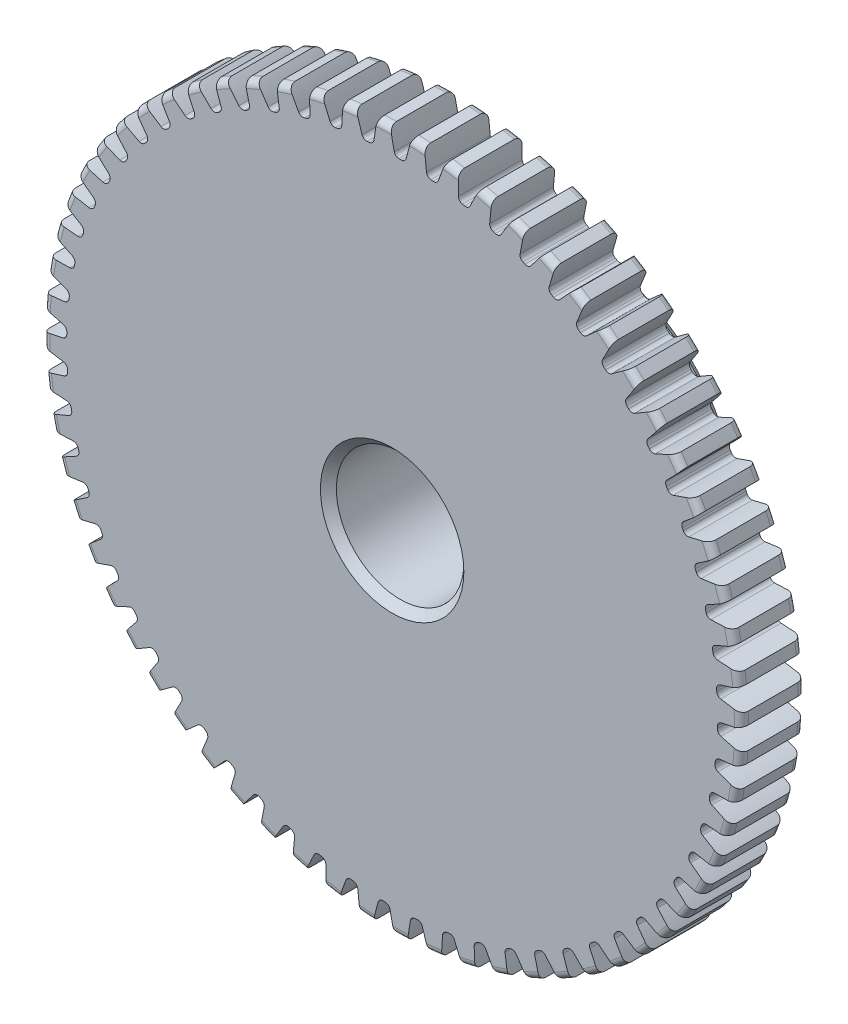
from build123d import *
from OCP.BRepAlgoAPI import BRepAlgoAPI_Cut
from OCP.TopTools import TopTools_ListOfShape

# Parameters (mm, degrees)
SKETCH1_R           = 17.399
BOSS_EXTRUDE1_DEPTH = 3.175
SKETCH2_W           = 6.35
SKETCH2_H           = 7.9375
FILLET2_R           = 0.34798
CUT_EXTRUDE1_DEPTH  = 27.385147849
FILLET1_R           = 0.249302159
CIRPATTERN1_START   = -4
CIRPATTERN1_DEPTH   = 5
SKETCH5_R           = 3.175
CUT_EXTRUDE2_DEPTH  = 27.384461792
CHAMFER1_SIZE       = 0.396875


with BuildPart() as part:
    # Sketch1 → Boss-Extrude1 (new body)
    with BuildSketch(Plane.XY):
        Circle(SKETCH1_R)
    extrude(amount=-BOSS_EXTRUDE1_DEPTH)

    # Sketch2 → Revolve1 (revolve)
    with BuildSketch(Plane(origin=(0, 0, 0), x_dir=(0, 0, -1), z_dir=(1, 0, 0)), mode=Mode.PRIVATE) as revolve1_sk:
        with Locations((6.35, 3.96875)):
            Rectangle(SKETCH2_W, SKETCH2_H)
    revolve(revolve1_sk.sketch.rotate(Axis((0, 0, -3.175), (0, 0, -1)), 90), axis=Axis((0, 0, -3.175), (0, 0, -1)))

    # Fillet2
    fillet2_edges = [part.edges().sort_by_distance(p)[0] for p in [
        (-17.399, 0, 0),
        (-17.399, 0, -3.175),
        (-7.9375, 0, -3.175),
    ]]
    fillet(fillet2_edges, radius=FILLET2_R)

    # Sketch4 → Cut-Extrude1 (cut, through all)
    with BuildSketch(Plane.XY):
        with BuildLine():
            Line((0.106506839, 16.389522157), (0.106506839, 16.208322725))
            ThreePointArc((0.106506839, 16.208322725), (0.39778167, 16.203790884), (0.688928013, 16.194025055))
            Line((0.688928013, 16.194025055), (0.697819068, 16.375006222))
            add(Edge.make_bspline(
                [(2.654676978, 19.79839862), (1.092607111, 18.320634432), (0.697819068, 16.375006222)],
                knots=[0, 0, 0, 1, 1, 1], degree=2))
            ThreePointArc((2.654676978, 19.79839862), (0.490226482, 19.969566239), (-1.680015643, 19.9048096))
            add(Edge.make_bspline(
                [(-1.680015643, 19.9048096), (-0.192337988, 18.352178138), (0.106506839, 16.389522157)],
                knots=[0, 0, 0, 1, 1, 1], degree=2))
        make_face()
    extrude(amount=-CUT_EXTRUDE1_DEPTH, mode=Mode.SUBTRACT)

    # Fillet1
    # the kernel refuses this fillet: 0.249302159 mm, written as the material it adds along each edge
    with BuildSketch(Plane(origin=(0.688928013, 16.194025055, 0), x_dir=(0.04906778897681205, 0.9987954505728023, 0), z_dir=(0, 0, -1))) as fillet1_piece_1:
        with BuildLine():
            CenterArc((0.24598848, -0.240736257), FILLET1_R, 105.063038018, 73.728001554)
            Line((-0.003258183, -0.235476287), (-0.008243116, -0.235371088))
            ThreePointArc((-0.008243116, -0.235371088), (-0.006186992, -0.117675078), (-0.004985936, 3.2763e-05))
            Line((-0.004985936, 3.2763e-05), (0, 0.004986043))
            ThreePointArc((0, 0.004986043), (0.090599716, 0.004986043), (0.17990365, 0.004814725))
            Line((0.17990365, 0.004814725), (0.181199431, 0))
        make_face()
    extrude(amount=3.175)
    with BuildSketch(Plane(origin=(0.106506839, 16.208322725, 0), x_dir=(0, 1, 0), z_dir=(0, 0, -1))) as fillet1_piece_2:
        with BuildLine():
            CenterArc((0.24598848, 0.240736257), FILLET1_R, 181.208960428, 73.728001554)
            Line((-0.003258183, 0.235476287), (-0.008243116, 0.235371088))
            ThreePointArc((-0.008243116, 0.235371088), (-0.006186992, 0.117675078), (-0.004985936, -3.2763e-05))
            Line((-0.004985936, -3.2763e-05), (0, -0.004986043))
            ThreePointArc((0, -0.004986043), (0.090599716, -0.004986043), (0.17990365, -0.004814725))
            Line((0.17990365, -0.004814725), (0.181199431, 0))
        make_face()
    extrude(amount=3.175)


with BuildPart() as cirpattern1_tool:
    # CirPattern1: read off the stored shape, not the designer's step
    # CirPattern1 outline → CirPattern1 (new body)
    with BuildSketch(Plane.XY.offset(CIRPATTERN1_START)):
        with BuildLine():
            ThreePointArc((-1.136714166, 16.168764646), (-0.99101727, 16.228975655), (-0.910572404, 16.364554321))
            add(Edge.make_bspline(
                [(-0.910572404, 16.364554321), (-0.857127813, 16.886611803), (-0.71930774, 17.384129347)],
                knots=[0, 0, 0, 0.264338862, 0.264338862, 0.264338862], degree=2))
            ThreePointArc((-0.71930774, 17.384129347), (-1.279948846, 17.351856729), (-1.839256768, 17.301512522))
            add(Edge.make_bspline(
                [(-1.839256768, 17.301512522), (-1.629927931, 16.829606686), (-1.500460114, 16.321041623)],
                knots=[0.735661138, 0.735661138, 0.735661138, 1, 1, 1], degree=2))
            ThreePointArc((-1.500460114, 16.321041623), (-1.400992434, 16.198734094), (-1.248037701, 16.160552935))
            ThreePointArc((-1.248037701, 16.160552935), (-1.192383003, 16.164754624), (-1.136714166, 16.168764646))
        make_face()
        with BuildLine():
            add(Edge.make_bspline(
                [(2.299490162, 16.227757862), (2.453756192, 16.729357633), (2.685988949, 17.190428155)],
                knots=[0, 0, 0, 0.264338862, 0.264338862, 0.264338862], degree=2))
            ThreePointArc((2.685988949, 17.190428155), (2.129824329, 17.268151301), (1.571441684, 17.327890005))
            add(Edge.make_bspline(
                [(1.571441684, 17.327890005), (1.684684065, 16.824213677), (1.712448073, 16.300162632)],
                knots=[0.735661138, 0.735661138, 0.735661138, 1, 1, 1], degree=2))
            ThreePointArc((1.712448073, 16.300162632), (1.786143493, 16.160800025), (1.928710469, 16.093512519))
            ThreePointArc((1.928710469, 16.093512519), (1.984115487, 16.08677578), (2.039496979, 16.0798483))
            ThreePointArc((2.039496979, 16.0798483), (2.194140936, 16.110478317), (2.299490162, 16.227757862))
        make_face()
        with BuildLine():
            add(Edge.make_bspline(
                [(3.879015908, 15.924227322), (4.08170448, 16.408291038), (4.358011787, 16.844378589)],
                knots=[0, 0, 0, 0.264338862, 0.264338862, 0.264338862], degree=2))
            ThreePointArc((4.358011787, 16.844378589), (3.812143452, 16.976241142), (3.262304989, 17.090423259))
            add(Edge.make_bspline(
                [(3.262304989, 17.090423259), (3.325633163, 16.578072576), (3.301897495, 16.05382363)],
                knots=[0.735661138, 0.735661138, 0.735661138, 1, 1, 1], degree=2))
            ThreePointArc((3.301897495, 16.05382363), (3.361578128, 15.907908679), (3.496863276, 15.826971173))
            ThreePointArc((3.496863276, 15.826971173), (3.551341188, 15.814836232), (3.605776991, 15.802513774))
            ThreePointArc((3.605776991, 15.802513774), (3.762678561, 15.81783854), (3.879015908, 15.924227322))
        make_face()
        with BuildLine():
            add(Edge.make_bspline(
                [(5.42118461, 15.467337769), (5.670343722, 15.929203631), (5.988064589, 16.336108449)],
                knots=[0, 0, 0, 0.264338862, 0.264338862, 0.264338862], degree=2))
            ThreePointArc((5.988064589, 16.336108449), (5.45774955, 16.520840501), (4.921750514, 16.688366394))
            add(Edge.make_bspline(
                [(4.921750514, 16.688366394), (4.934554597, 16.172275572), (4.85954784, 15.652877532)],
                knots=[0.735661138, 0.735661138, 0.735661138, 1, 1, 1], degree=2))
            ThreePointArc((4.85954784, 15.652877532), (4.904638928, 15.501815475), (5.031339378, 15.408007442))
            ThreePointArc((5.031339378, 15.408007442), (5.084365532, 15.390591165), (5.1373314, 15.372992401))
            ThreePointArc((5.1373314, 15.372992401), (5.294979536, 15.372864332), (5.42118461, 15.467337769))
        make_face()
        with BuildLine():
            add(Edge.make_bspline(
                [(6.911144341, 14.861489297), (7.204374455, 15.296709286), (7.560449055, 15.670512655)],
                knots=[0, 0, 0, 0.264338862, 0.264338862, 0.264338862], degree=2))
            ThreePointArc((7.560449055, 15.670512655), (7.050794536, 15.906335135), (6.533796891, 16.125591437))
            add(Edge.make_bspline(
                [(6.533796891, 16.125591437), (6.495953572, 15.610730715), (6.370398082, 15.101185665)],
                knots=[0.735661138, 0.735661138, 0.735661138, 1, 1, 1], degree=2))
            ThreePointArc((6.370398082, 15.101185665), (6.400465374, 14.946431315), (6.517360931, 14.840656177))
            ThreePointArc((6.517360931, 14.840656177), (6.568424656, 14.818126292), (6.619410498, 14.795420708))
            ThreePointArc((6.619410498, 14.795420708), (6.776286962, 14.779841036), (6.911144341, 14.861489297))
        make_face()
        with BuildLine():
            add(Edge.make_bspline(
                [(8.334545974, 14.112516559), (8.669023124, 14.516899267), (9.060022264, 14.854001257)],
                knots=[0, 0, 0, 0.264338862, 0.264338862, 0.264338862], degree=2))
            ThreePointArc((9.060022264, 14.854001257), (8.575936516, 15.138643067), (8.082919232, 15.40751822))
            add(Edge.make_bspline(
                [(8.082919232, 15.40751822), (7.994792963, 14.898845987), (7.819897909, 14.404061126)],
                knots=[0.735661138, 0.735661138, 0.735661138, 1, 1, 1], degree=2))
            ThreePointArc((7.819897909, 14.404061126), (7.834651839, 14.24710485), (7.940616736, 14.13038128))
            ThreePointArc((7.940616736, 14.13038128), (7.98922626, 14.102954763), (8.037741055, 14.075361026))
            ThreePointArc((8.037741055, 14.075361026), (8.192335041, 14.044479791), (8.334545974, 14.112516559))
        make_face()
        with BuildLine():
            add(Edge.make_bspline(
                [(9.677681373, 13.227632573), (10.05018436, 13.597283574), (10.472342506, 13.894437707)],
                knots=[0, 0, 0, 0.264338862, 0.264338862, 0.264338862], degree=2))
            ThreePointArc((10.472342506, 13.894437707), (10.018487539, 14.22515759), (9.554198642, 14.54106218))
            add(Edge.make_bspline(
                [(9.554198642, 14.54106218), (9.416638128, 14.043477227), (9.194087844, 13.568217604)],
                knots=[0.735661138, 0.735661138, 0.735661138, 1, 1, 1], degree=2))
            ThreePointArc((9.194087844, 13.568217604), (9.193386324, 13.410570977), (9.287400061, 13.284023087))
            ThreePointArc((9.287400061, 13.284023087), (9.333087248, 13.251964069), (9.378663772, 13.219747922))
            ThreePointArc((9.378663772, 13.219747922), (9.529486456, 13.173862529), (9.677681373, 13.227632573))
        make_face()
        with BuildLine():
            add(Edge.make_bspline(
                [(10.92761541, 12.215359253), (11.334556828, 12.546718606), (11.783808365, 12.801063127)],
                knots=[0, 0, 0, 0.264338862, 0.264338862, 0.264338862], degree=2))
            ThreePointArc((11.783808365, 12.801063127), (11.364555051, 13.174676069), (10.933465897, 13.534567763))
            add(Edge.make_bspline(
                [(10.933465897, 13.534567763), (10.747795919, 13.052862105), (10.479733687, 12.601704729)],
                knots=[0.735661138, 0.735661138, 0.735661138, 1, 1, 1], degree=2))
            ThreePointArc((10.479733687, 12.601704729), (10.463583474, 12.444885975), (10.544740646, 12.30973249))
            ThreePointArc((10.544740646, 12.30973249), (10.587065504, 12.273349718), (10.62926483, 12.23682142))
            ThreePointArc((10.62926483, 12.23682142), (10.774863706, 12.176373769), (10.92761541, 12.215359253))
        make_face()
        with BuildLine():
            add(Edge.make_bspline(
                [(12.072310537, 11.085445346), (12.509771317, 11.375321879), (12.981789708, 11.584407311)],
                knots=[0, 0, 0, 0.264338862, 0.264338862, 0.264338862], degree=2))
            ThreePointArc((12.981789708, 11.584407311), (12.601175686, 11.997315215), (12.207437898, 12.397728058))
            add(Edge.make_bspline(
                [(12.207437898, 12.397728058), (11.975446561, 11.936540786), (11.664453965, 11.513830549)],
                knots=[0.735661138, 0.735661138, 0.735661138, 1, 1, 1], degree=2))
            ThreePointArc((11.664453965, 11.513830549), (11.633010594, 11.359349918), (11.700529615, 11.21689244))
            ThreePointArc((11.700529615, 11.21689244), (11.739084531, 11.176536299), (11.777500257, 11.136047638))
            ThreePointArc((11.777500257, 11.136047638), (11.916473128, 11.061619873), (12.072310537, 11.085445346))
        make_face()
        with BuildLine():
            add(Edge.make_bspline(
                [(13.100742714, 9.848772541), (13.56450987, 10.094374585), (14.054749319, 10.25618732)],
                knots=[0, 0, 0, 0.264338862, 0.264338862, 0.264338862], degree=2))
            ThreePointArc((14.054749319, 10.25618732), (13.716440109, 10.704413658), (13.363845598, 11.141491456))
            add(Edge.make_bspline(
                [(13.363845598, 11.141491456), (13.087767106, 10.705264053), (12.736839176, 10.315071887)],
                knots=[0.735661138, 0.735661138, 0.735661138, 1, 1, 1], degree=2))
            ThreePointArc((12.736839176, 10.315071887), (12.690405464, 10.164417111), (12.743636087, 10.016027584))
            ThreePointArc((12.743636087, 10.016027584), (12.778049757, 9.972086726), (12.812311918, 9.928027629))
            ThreePointArc((12.812311918, 9.928027629), (12.9433204, 9.840336531), (13.100742714, 9.848772541))
        make_face()
        with BuildLine():
            add(Edge.make_bspline(
                [(14.003007577, 8.517250672), (14.488614777, 8.716212944), (14.992354012, 8.829194638)],
                knots=[0, 0, 0, 0.264338862, 0.264338862, 0.264338862], degree=2))
            ThreePointArc((14.992354012, 8.829194638), (14.699607717, 9.308422745), (14.391552161, 9.7779562))
            add(Edge.make_bspline(
                [(14.391552161, 9.7779562), (14.074045299, 9.370889776), (13.686561663, 9.016973444)],
                knots=[0.735661138, 0.735661138, 0.735661138, 1, 1, 1], degree=2))
            ThreePointArc((13.686561663, 9.016973444), (13.625584791, 8.871595411), (13.664014377, 8.718702906))
            ThreePointArc((13.664014377, 8.718702906), (13.693955379, 8.671600507), (13.723734011, 8.624395287))
            ThreePointArc((13.723734011, 8.624395287), (13.845516421, 8.524285369), (14.003007577, 8.517250672))
        make_face()
        with BuildLine():
            add(Edge.make_bspline(
                [(14.770415823, 7.103703023), (15.273186404, 7.254109409), (15.785574139, 7.317171986)],
                knots=[0, 0, 0, 0.264338862, 0.264338862, 0.264338862], degree=2))
            ThreePointArc((15.785574139, 7.317171986), (15.541210067, 7.822786633), (15.280660208, 8.32025388))
            add(Edge.make_bspline(
                [(15.280660208, 8.32025388), (14.924782742, 7.946268707), (14.504475079, 7.632036617)],
                knots=[0.735661138, 0.735661138, 0.735661138, 1, 1, 1], degree=2))
            ThreePointArc((14.504475079, 7.632036617), (14.429542288, 7.493335398), (14.45280074, 7.337412354))
            ThreePointArc((14.45280074, 7.337412354), (14.477980725, 7.287602034), (14.502989044, 7.237705304))
            ThreePointArc((14.502989044, 7.237705304), (14.614372551, 7.126140679), (14.770415823, 7.103703023))
        make_face()
        with BuildLine():
            add(Edge.make_bspline(
                [(15.39557689, 5.621742831), (15.910668897, 5.722144834), (16.426770558, 5.734680967)],
                knots=[0, 0, 0, 0.264338862, 0.264338862, 0.264338862], degree=2))
            ThreePointArc((16.426770558, 5.734680967), (16.233142067, 6.261812809), (16.022607145, 6.782422968))
            add(Edge.make_bspline(
                [(16.022607145, 6.782422968), (15.631786369, 6.445120727), (15.182702471, 6.173599105)],
                knots=[0.735661138, 0.735661138, 0.735661138, 1, 1, 1], degree=2))
            ThreePointArc((15.182702471, 6.173599105), (15.094535405, 6.042910469), (15.10239873, 5.88545851))
            ThreePointArc((15.10239873, 5.88545851), (15.122575202, 5.83341997), (15.142572364, 5.781312263))
            ThreePointArc((15.142572364, 5.781312263), (15.242484283, 5.659367359), (15.39557689, 5.621742831))
        make_face()
        with BuildLine():
            add(Edge.make_bspline(
                [(15.872470135, 4.085642183), (16.394922951, 4.135072877), (16.909768197, 4.096961836)],
                knots=[0, 0, 0, 0.264338862, 0.264338862, 0.264338862], degree=2))
            ThreePointArc((16.909768197, 4.096961836), (16.768740036, 4.640534305), (16.610247616, 5.179273615))
            add(Edge.make_bspline(
                [(16.610247616, 5.179273615), (16.188247347, 4.881902711), (15.714712138, 4.655706459)],
                knots=[0.735661138, 0.735661138, 0.735661138, 1, 1, 1], degree=2))
            ThreePointArc((15.714712138, 4.655706459), (15.614159895, 4.534289008), (15.606552365, 4.376824483))
            ThreePointArc((15.606552365, 4.376824483), (15.621531013, 4.323058883), (15.636324435, 4.269242023))
            ThreePointArc((15.636324435, 4.269242023), (15.72380256, 4.138091237), (15.872470135, 4.085642183))
        make_face()
        with BuildLine():
            add(Edge.make_bspline(
                [(16.196502816, 2.510194566), (16.721284934, 2.508177907), (17.229915525, 2.419786722)],
                knots=[0, 0, 0, 0.264338862, 0.264338862, 0.264338862], degree=2))
            ThreePointArc((17.229915525, 2.419786722), (17.142845872, 2.974564919), (17.037922323, 3.526245025))
            add(Edge.make_bspline(
                [(17.037922323, 3.526245025), (16.588806655, 3.271669303), (16.095380538, 3.092976815)],
                knots=[0.735661138, 0.735661138, 0.735661138, 1, 1, 1], degree=2))
            ThreePointArc((16.095380538, 3.092976815), (15.983411489, 2.981999866), (15.960406369, 2.826039244))
            ThreePointArc((15.960406369, 2.826039244), (15.97004294, 2.771064375), (15.979490153, 2.71605665))
            ThreePointArc((15.979490153, 2.71605665), (16.053692022, 2.576963035), (16.196502816, 2.510194566))
        make_face()
        with BuildLine():
            add(Edge.make_bspline(
                [(16.364554321, 0.910572404), (16.886611803, 0.857127813), (17.384129347, 0.71930774)],
                knots=[0, 0, 0, 0.264338862, 0.264338862, 0.264338862], degree=2))
            ThreePointArc((17.384129347, 0.71930774), (17.351856731, 1.279948846), (17.301512523, 1.839256768))
            add(Edge.make_bspline(
                [(17.301512523, 1.839256768), (16.829606686, 1.629927931), (16.321041623, 1.500460114)],
                knots=[0.735661138, 0.735661138, 0.735661138, 1, 1, 1], degree=2))
            ThreePointArc((16.321041623, 1.500460114), (16.198734094, 1.400992434), (16.160552935, 1.248037701))
            ThreePointArc((16.160552935, 1.248037701), (16.164754624, 1.192383003), (16.168764646, 1.136714166))
            ThreePointArc((16.168764646, 1.136714166), (16.228975655, 0.99101727), (16.364554321, 0.910572404))
        make_face()
        with BuildLine():
            add(Edge.make_bspline(
                [(16.375006222, -0.697819068), (16.889311368, -0.80217689), (17.3709245, -0.988098569)],
                knots=[0, 0, 0, 0.264338862, 0.264338862, 0.264338862], degree=2))
            ThreePointArc((17.3709245, -0.988098569), (17.393759723, -0.426993833), (17.3984797, 0.134555463))
            add(Edge.make_bspline(
                [(17.3984797, 0.134555463), (16.908328404, -0.027510538), (16.389522157, -0.106506839)],
                knots=[0.735661138, 0.735661138, 0.735661138, 1, 1, 1], degree=2))
            ThreePointArc((16.389522157, -0.106506839), (16.258054033, -0.19350732), (16.205064542, -0.341983126))
            ThreePointArc((16.205064542, -0.341983126), (16.203790884, -0.39778167), (16.202325097, -0.453575497))
            ThreePointArc((16.202325097, -0.453575497), (16.24796538, -0.604472533), (16.375006222, -0.697819068))
        make_face()
        with BuildLine():
            add(Edge.make_bspline(
                [(16.227757862, -2.299490162), (16.729357633, -2.453756192), (17.190428155, -2.685988949)],
                knots=[0, 0, 0, 0.264338862, 0.264338862, 0.264338862], degree=2))
            ThreePointArc((17.190428155, -2.685988949), (17.268151302, -2.129824329), (17.327890007, -1.571441684))
            add(Edge.make_bspline(
                [(17.327890007, -1.571441684), (16.824213677, -1.684684065), (16.300162632, -1.712448073)],
                knots=[0.735661138, 0.735661138, 0.735661138, 1, 1, 1], degree=2))
            ThreePointArc((16.300162632, -1.712448073), (16.160800025, -1.786143493), (16.093512519, -1.928710469))
            ThreePointArc((16.093512519, -1.928710469), (16.08677578, -1.984115487), (16.0798483, -2.039496979))
            ThreePointArc((16.0798483, -2.039496979), (16.110478317, -2.194140936), (16.227757862, -2.299490162))
        make_face()
        with BuildLine():
            add(Edge.make_bspline(
                [(15.924227322, -3.879015908), (16.408291038, -4.08170448), (16.844378589, -4.358011787)],
                knots=[0, 0, 0, 0.264338862, 0.264338862, 0.264338862], degree=2))
            ThreePointArc((16.844378589, -4.358011787), (16.976241143, -3.812143452), (17.09042326, -3.26230499))
            add(Edge.make_bspline(
                [(17.09042326, -3.26230499), (16.578072576, -3.325633163), (16.05382363, -3.301897495)],
                knots=[0.735661138, 0.735661138, 0.735661138, 1, 1, 1], degree=2))
            ThreePointArc((16.05382363, -3.301897495), (15.907908679, -3.361578128), (15.826971173, -3.496863276))
            ThreePointArc((15.826971173, -3.496863276), (15.814836232, -3.551341188), (15.802513774, -3.605776991))
            ThreePointArc((15.802513774, -3.605776991), (15.81783854, -3.762678561), (15.924227322, -3.879015908))
        make_face()
        with BuildLine():
            add(Edge.make_bspline(
                [(15.467337769, -5.42118461), (15.929203631, -5.670343722), (16.336108449, -5.988064589)],
                knots=[0, 0, 0, 0.264338862, 0.264338862, 0.264338862], degree=2))
            ThreePointArc((16.336108449, -5.988064589), (16.520840502, -5.45774955), (16.688366395, -4.921750514))
            add(Edge.make_bspline(
                [(16.688366395, -4.921750514), (16.172275572, -4.934554597), (15.652877532, -4.85954784)],
                knots=[0.735661138, 0.735661138, 0.735661138, 1, 1, 1], degree=2))
            ThreePointArc((15.652877532, -4.85954784), (15.501815475, -4.904638928), (15.408007442, -5.031339378))
            ThreePointArc((15.408007442, -5.031339378), (15.390591165, -5.084365532), (15.372992401, -5.1373314))
            ThreePointArc((15.372992401, -5.1373314), (15.372864332, -5.294979536), (15.467337769, -5.42118461))
        make_face()
        with BuildLine():
            add(Edge.make_bspline(
                [(14.861489297, -6.911144341), (15.296709286, -7.204374455), (15.670512655, -7.560449055)],
                knots=[0, 0, 0, 0.264338862, 0.264338862, 0.264338862], degree=2))
            ThreePointArc((15.670512655, -7.560449055), (15.906335136, -7.050794536), (16.125591438, -6.533796891))
            add(Edge.make_bspline(
                [(16.125591438, -6.533796891), (15.610730715, -6.495953572), (15.101185665, -6.370398082)],
                knots=[0.735661138, 0.735661138, 0.735661138, 1, 1, 1], degree=2))
            ThreePointArc((15.101185665, -6.370398082), (14.946431315, -6.400465374), (14.840656177, -6.517360931))
            ThreePointArc((14.840656177, -6.517360931), (14.818126292, -6.568424656), (14.795420708, -6.619410498))
            ThreePointArc((14.795420708, -6.619410498), (14.779841036, -6.776286962), (14.861489297, -6.911144341))
        make_face()
        with BuildLine():
            add(Edge.make_bspline(
                [(14.112516559, -8.334545974), (14.516899267, -8.669023124), (14.854001257, -9.060022264)],
                knots=[0, 0, 0, 0.264338862, 0.264338862, 0.264338862], degree=2))
            ThreePointArc((14.854001257, -9.060022264), (15.138643067, -8.575936516), (15.407518221, -8.082919232))
            add(Edge.make_bspline(
                [(15.407518221, -8.082919232), (14.898845987, -7.994792963), (14.404061126, -7.819897909)],
                knots=[0.735661138, 0.735661138, 0.735661138, 1, 1, 1], degree=2))
            ThreePointArc((14.404061126, -7.819897909), (14.24710485, -7.834651839), (14.13038128, -7.940616736))
            ThreePointArc((14.13038128, -7.940616736), (14.102954763, -7.98922626), (14.075361026, -8.037741055))
            ThreePointArc((14.075361026, -8.037741055), (14.044479791, -8.192335041), (14.112516559, -8.334545974))
        make_face()
        with BuildLine():
            add(Edge.make_bspline(
                [(13.227632573, -9.677681373), (13.597283574, -10.05018436), (13.894437707, -10.472342506)],
                knots=[0, 0, 0, 0.264338862, 0.264338862, 0.264338862], degree=2))
            ThreePointArc((13.894437707, -10.472342506), (14.22515759, -10.01848754), (14.541062181, -9.554198642))
            add(Edge.make_bspline(
                [(14.541062181, -9.554198642), (14.043477227, -9.416638128), (13.568217604, -9.194087844)],
                knots=[0.735661138, 0.735661138, 0.735661138, 1, 1, 1], degree=2))
            ThreePointArc((13.568217604, -9.194087844), (13.410570977, -9.193386324), (13.284023087, -9.287400061))
            ThreePointArc((13.284023087, -9.287400061), (13.251964069, -9.333087248), (13.219747922, -9.378663772))
            ThreePointArc((13.219747922, -9.378663772), (13.173862529, -9.529486456), (13.227632573, -9.677681373))
        make_face()
        with BuildLine():
            add(Edge.make_bspline(
                [(12.215359253, -10.92761541), (12.546718606, -11.334556828), (12.801063127, -11.783808365)],
                knots=[0, 0, 0, 0.264338862, 0.264338862, 0.264338862], degree=2))
            ThreePointArc((12.801063127, -11.783808365), (13.174676069, -11.364555051), (13.534567763, -10.933465897))
            add(Edge.make_bspline(
                [(13.534567763, -10.933465897), (13.052862105, -10.747795919), (12.601704729, -10.479733687)],
                knots=[0.735661138, 0.735661138, 0.735661138, 1, 1, 1], degree=2))
            ThreePointArc((12.601704729, -10.479733687), (12.444885975, -10.463583474), (12.30973249, -10.544740646))
            ThreePointArc((12.30973249, -10.544740646), (12.273349718, -10.587065504), (12.23682142, -10.62926483))
            ThreePointArc((12.23682142, -10.62926483), (12.176373769, -10.774863706), (12.215359253, -10.92761541))
        make_face()
        with BuildLine():
            add(Edge.make_bspline(
                [(11.085445346, -12.072310537), (11.375321879, -12.509771317), (11.584407311, -12.981789708)],
                knots=[0, 0, 0, 0.264338862, 0.264338862, 0.264338862], degree=2))
            ThreePointArc((11.584407311, -12.981789708), (11.997315215, -12.601175685), (12.397728058, -12.207437898))
            add(Edge.make_bspline(
                [(12.397728058, -12.207437898), (11.936540786, -11.975446561), (11.513830549, -11.664453965)],
                knots=[0.735661138, 0.735661138, 0.735661138, 1, 1, 1], degree=2))
            ThreePointArc((11.513830549, -11.664453965), (11.359349918, -11.633010594), (11.21689244, -11.700529615))
            ThreePointArc((11.21689244, -11.700529615), (11.176536299, -11.739084531), (11.136047638, -11.777500257))
            ThreePointArc((11.136047638, -11.777500257), (11.061619873, -11.916473128), (11.085445346, -12.072310537))
        make_face()
        with BuildLine():
            add(Edge.make_bspline(
                [(9.848772541, -13.100742714), (10.094374585, -13.56450987), (10.25618732, -14.054749319)],
                knots=[0, 0, 0, 0.264338862, 0.264338862, 0.264338862], degree=2))
            ThreePointArc((10.25618732, -14.054749319), (10.704413658, -13.716440109), (11.141491456, -13.363845598))
            add(Edge.make_bspline(
                [(11.141491456, -13.363845598), (10.705264053, -13.087767106), (10.315071887, -12.736839176)],
                knots=[0.735661138, 0.735661138, 0.735661138, 1, 1, 1], degree=2))
            ThreePointArc((10.315071887, -12.736839176), (10.164417111, -12.690405464), (10.016027584, -12.743636087))
            ThreePointArc((10.016027584, -12.743636087), (9.972086726, -12.778049757), (9.928027629, -12.812311918))
            ThreePointArc((9.928027629, -12.812311918), (9.840336531, -12.9433204), (9.848772541, -13.100742714))
        make_face()
        with BuildLine():
            add(Edge.make_bspline(
                [(8.517250672, -14.003007577), (8.716212944, -14.488614777), (8.829194638, -14.992354012)],
                knots=[0, 0, 0, 0.264338862, 0.264338862, 0.264338862], degree=2))
            ThreePointArc((8.829194638, -14.992354012), (9.308422745, -14.699607717), (9.7779562, -14.39155216))
            add(Edge.make_bspline(
                [(9.7779562, -14.39155216), (9.370889776, -14.074045299), (9.016973444, -13.686561663)],
                knots=[0.735661138, 0.735661138, 0.735661138, 1, 1, 1], degree=2))
            ThreePointArc((9.016973444, -13.686561663), (8.871595411, -13.625584791), (8.718702906, -13.664014377))
            ThreePointArc((8.718702906, -13.664014377), (8.671600507, -13.693955379), (8.624395287, -13.723734011))
            ThreePointArc((8.624395287, -13.723734011), (8.524285369, -13.845516421), (8.517250672, -14.003007577))
        make_face()
        with BuildLine():
            add(Edge.make_bspline(
                [(7.103703023, -14.770415823), (7.254109409, -15.273186404), (7.317171986, -15.785574139)],
                knots=[0, 0, 0, 0.264338862, 0.264338862, 0.264338862], degree=2))
            ThreePointArc((7.317171986, -15.785574139), (7.822786633, -15.541210066), (8.32025388, -15.280660208))
            add(Edge.make_bspline(
                [(8.32025388, -15.280660208), (7.946268707, -14.924782742), (7.632036617, -14.504475079)],
                knots=[0.735661138, 0.735661138, 0.735661138, 1, 1, 1], degree=2))
            ThreePointArc((7.632036617, -14.504475079), (7.493335398, -14.429542288), (7.337412354, -14.45280074))
            ThreePointArc((7.337412354, -14.45280074), (7.287602034, -14.477980725), (7.237705304, -14.502989044))
            ThreePointArc((7.237705304, -14.502989044), (7.126140679, -14.614372551), (7.103703023, -14.770415823))
        make_face()
        with BuildLine():
            add(Edge.make_bspline(
                [(5.621742831, -15.39557689), (5.722144834, -15.910668897), (5.734680967, -16.426770558)],
                knots=[0, 0, 0, 0.264338862, 0.264338862, 0.264338862], degree=2))
            ThreePointArc((5.734680967, -16.426770558), (6.261812809, -16.233142067), (6.782422968, -16.022607144))
            add(Edge.make_bspline(
                [(6.782422968, -16.022607144), (6.445120727, -15.631786369), (6.173599105, -15.182702471)],
                knots=[0.735661138, 0.735661138, 0.735661138, 1, 1, 1], degree=2))
            ThreePointArc((6.173599105, -15.182702471), (6.042910469, -15.094535405), (5.88545851, -15.10239873))
            ThreePointArc((5.88545851, -15.10239873), (5.83341997, -15.122575202), (5.781312263, -15.142572364))
            ThreePointArc((5.781312263, -15.142572364), (5.659367359, -15.242484283), (5.621742831, -15.39557689))
        make_face()
        with BuildLine():
            add(Edge.make_bspline(
                [(4.085642183, -15.872470135), (4.135072877, -16.394922951), (4.096961836, -16.909768197)],
                knots=[0, 0, 0, 0.264338862, 0.264338862, 0.264338862], degree=2))
            ThreePointArc((4.096961836, -16.909768197), (4.640534305, -16.768740035), (5.179273614, -16.610247615))
            add(Edge.make_bspline(
                [(5.179273614, -16.610247615), (4.881902711, -16.188247347), (4.655706459, -15.714712138)],
                knots=[0.735661138, 0.735661138, 0.735661138, 1, 1, 1], degree=2))
            ThreePointArc((4.655706459, -15.714712138), (4.534289008, -15.614159895), (4.376824483, -15.606552365))
            ThreePointArc((4.376824483, -15.606552365), (4.323058883, -15.621531013), (4.269242023, -15.636324435))
            ThreePointArc((4.269242023, -15.636324435), (4.138091237, -15.72380256), (4.085642183, -15.872470135))
        make_face()
        with BuildLine():
            add(Edge.make_bspline(
                [(2.510194566, -16.196502816), (2.508177907, -16.721284934), (2.419786722, -17.229915525)],
                knots=[0, 0, 0, 0.264338862, 0.264338862, 0.264338862], degree=2))
            ThreePointArc((2.419786722, -17.229915525), (2.974564919, -17.142845871), (3.526245025, -17.037922322))
            add(Edge.make_bspline(
                [(3.526245025, -17.037922322), (3.271669303, -16.588806655), (3.092976815, -16.095380538)],
                knots=[0.735661138, 0.735661138, 0.735661138, 1, 1, 1], degree=2))
            ThreePointArc((3.092976815, -16.095380538), (2.981999866, -15.983411489), (2.826039244, -15.960406369))
            ThreePointArc((2.826039244, -15.960406369), (2.771064375, -15.97004294), (2.71605665, -15.979490153))
            ThreePointArc((2.71605665, -15.979490153), (2.576963035, -16.053692022), (2.510194566, -16.196502816))
        make_face()
        with BuildLine():
            add(Edge.make_bspline(
                [(0.910572404, -16.364554321), (0.857127813, -16.886611803), (0.71930774, -17.384129347)],
                knots=[0, 0, 0, 0.264338862, 0.264338862, 0.264338862], degree=2))
            ThreePointArc((0.71930774, -17.384129347), (1.279948846, -17.351856729), (1.839256768, -17.301512522))
            add(Edge.make_bspline(
                [(1.839256768, -17.301512522), (1.629927931, -16.829606686), (1.500460114, -16.321041623)],
                knots=[0.735661138, 0.735661138, 0.735661138, 1, 1, 1], degree=2))
            ThreePointArc((1.500460114, -16.321041623), (1.400992434, -16.198734094), (1.248037701, -16.160552935))
            ThreePointArc((1.248037701, -16.160552935), (1.192383003, -16.164754624), (1.136714166, -16.168764646))
            ThreePointArc((1.136714166, -16.168764646), (0.99101727, -16.228975655), (0.910572404, -16.364554321))
        make_face()
        with BuildLine():
            add(Edge.make_bspline(
                [(-0.697819068, -16.375006222), (-0.80217689, -16.889311368), (-0.988098569, -17.3709245)],
                knots=[0, 0, 0, 0.264338862, 0.264338862, 0.264338862], degree=2))
            ThreePointArc((-0.988098569, -17.3709245), (-0.426993833, -17.393759722), (0.134555463, -17.398479699))
            add(Edge.make_bspline(
                [(0.134555463, -17.398479699), (-0.027510538, -16.908328404), (-0.106506839, -16.389522157)],
                knots=[0.735661138, 0.735661138, 0.735661138, 1, 1, 1], degree=2))
            ThreePointArc((-0.106506839, -16.389522157), (-0.19350732, -16.258054033), (-0.341983126, -16.205064542))
            ThreePointArc((-0.341983126, -16.205064542), (-0.39778167, -16.203790884), (-0.453575497, -16.202325097))
            ThreePointArc((-0.453575497, -16.202325097), (-0.604472533, -16.24796538), (-0.697819068, -16.375006222))
        make_face()
        with BuildLine():
            add(Edge.make_bspline(
                [(-2.299490162, -16.227757862), (-2.453756192, -16.729357633), (-2.685988949, -17.190428155)],
                knots=[0, 0, 0, 0.264338862, 0.264338862, 0.264338862], degree=2))
            ThreePointArc((-2.685988949, -17.190428155), (-2.129824329, -17.2681513), (-1.571441684, -17.327890005))
            add(Edge.make_bspline(
                [(-1.571441684, -17.327890005), (-1.684684065, -16.824213677), (-1.712448073, -16.300162632)],
                knots=[0.735661138, 0.735661138, 0.735661138, 1, 1, 1], degree=2))
            ThreePointArc((-1.712448073, -16.300162632), (-1.786143493, -16.160800025), (-1.928710469, -16.093512519))
            ThreePointArc((-1.928710469, -16.093512519), (-1.984115487, -16.08677578), (-2.039496979, -16.0798483))
            ThreePointArc((-2.039496979, -16.0798483), (-2.194140936, -16.110478317), (-2.299490162, -16.227757862))
        make_face()
        with BuildLine():
            add(Edge.make_bspline(
                [(-3.879015908, -15.924227322), (-4.08170448, -16.408291038), (-4.358011787, -16.844378589)],
                knots=[0, 0, 0, 0.264338862, 0.264338862, 0.264338862], degree=2))
            ThreePointArc((-4.358011787, -16.844378589), (-3.812143452, -16.976241142), (-3.262304989, -17.090423258))
            add(Edge.make_bspline(
                [(-3.262304989, -17.090423258), (-3.325633163, -16.578072576), (-3.301897495, -16.05382363)],
                knots=[0.735661138, 0.735661138, 0.735661138, 1, 1, 1], degree=2))
            ThreePointArc((-3.301897495, -16.05382363), (-3.361578128, -15.907908679), (-3.496863276, -15.826971173))
            ThreePointArc((-3.496863276, -15.826971173), (-3.551341188, -15.814836232), (-3.605776991, -15.802513774))
            ThreePointArc((-3.605776991, -15.802513774), (-3.762678561, -15.81783854), (-3.879015908, -15.924227322))
        make_face()
        with BuildLine():
            add(Edge.make_bspline(
                [(-5.42118461, -15.467337769), (-5.670343722, -15.929203631), (-5.988064589, -16.336108449)],
                knots=[0, 0, 0, 0.264338862, 0.264338862, 0.264338862], degree=2))
            ThreePointArc((-5.988064589, -16.336108449), (-5.457749549, -16.520840501), (-4.921750514, -16.688366393))
            add(Edge.make_bspline(
                [(-4.921750514, -16.688366393), (-4.934554597, -16.172275572), (-4.85954784, -15.652877532)],
                knots=[0.735661138, 0.735661138, 0.735661138, 1, 1, 1], degree=2))
            ThreePointArc((-4.85954784, -15.652877532), (-4.904638928, -15.501815475), (-5.031339378, -15.408007442))
            ThreePointArc((-5.031339378, -15.408007442), (-5.084365532, -15.390591165), (-5.1373314, -15.372992401))
            ThreePointArc((-5.1373314, -15.372992401), (-5.294979536, -15.372864332), (-5.42118461, -15.467337769))
        make_face()
        with BuildLine():
            add(Edge.make_bspline(
                [(-6.911144341, -14.861489297), (-7.204374455, -15.296709286), (-7.560449055, -15.670512655)],
                knots=[0, 0, 0, 0.264338862, 0.264338862, 0.264338862], degree=2))
            ThreePointArc((-7.560449055, -15.670512655), (-7.050794535, -15.906335134), (-6.533796891, -16.125591437))
            add(Edge.make_bspline(
                [(-6.533796891, -16.125591437), (-6.495953572, -15.610730715), (-6.370398082, -15.101185665)],
                knots=[0.735661138, 0.735661138, 0.735661138, 1, 1, 1], degree=2))
            ThreePointArc((-6.370398082, -15.101185665), (-6.400465374, -14.946431315), (-6.517360931, -14.840656177))
            ThreePointArc((-6.517360931, -14.840656177), (-6.568424656, -14.818126292), (-6.619410498, -14.795420708))
            ThreePointArc((-6.619410498, -14.795420708), (-6.776286962, -14.779841036), (-6.911144341, -14.861489297))
        make_face()
        with BuildLine():
            add(Edge.make_bspline(
                [(-8.334545974, -14.112516559), (-8.669023124, -14.516899267), (-9.060022264, -14.854001257)],
                knots=[0, 0, 0, 0.264338862, 0.264338862, 0.264338862], degree=2))
            ThreePointArc((-9.060022264, -14.854001257), (-8.575936515, -15.138643066), (-8.082919231, -15.407518219))
            add(Edge.make_bspline(
                [(-8.082919231, -15.407518219), (-7.994792963, -14.898845987), (-7.819897909, -14.404061126)],
                knots=[0.735661138, 0.735661138, 0.735661138, 1, 1, 1], degree=2))
            ThreePointArc((-7.819897909, -14.404061126), (-7.834651839, -14.24710485), (-7.940616736, -14.13038128))
            ThreePointArc((-7.940616736, -14.13038128), (-7.98922626, -14.102954763), (-8.037741055, -14.075361026))
            ThreePointArc((-8.037741055, -14.075361026), (-8.192335041, -14.044479791), (-8.334545974, -14.112516559))
        make_face()
        with BuildLine():
            add(Edge.make_bspline(
                [(-9.677681373, -13.227632573), (-10.05018436, -13.597283574), (-10.472342506, -13.894437707)],
                knots=[0, 0, 0, 0.264338862, 0.264338862, 0.264338862], degree=2))
            ThreePointArc((-10.472342506, -13.894437707), (-10.018487539, -14.225157588), (-9.554198641, -14.541062179))
            add(Edge.make_bspline(
                [(-9.554198641, -14.541062179), (-9.416638128, -14.043477227), (-9.194087844, -13.568217604)],
                knots=[0.735661138, 0.735661138, 0.735661138, 1, 1, 1], degree=2))
            ThreePointArc((-9.194087844, -13.568217604), (-9.193386324, -13.410570977), (-9.287400061, -13.284023087))
            ThreePointArc((-9.287400061, -13.284023087), (-9.333087248, -13.251964069), (-9.378663772, -13.219747922))
            ThreePointArc((-9.378663772, -13.219747922), (-9.529486456, -13.173862529), (-9.677681373, -13.227632573))
        make_face()
        with BuildLine():
            add(Edge.make_bspline(
                [(-10.92761541, -12.215359253), (-11.334556828, -12.546718606), (-11.783808365, -12.801063127)],
                knots=[0, 0, 0, 0.264338862, 0.264338862, 0.264338862], degree=2))
            ThreePointArc((-11.783808365, -12.801063127), (-11.36455505, -13.174676068), (-10.933465896, -13.534567761))
            add(Edge.make_bspline(
                [(-10.933465896, -13.534567761), (-10.747795919, -13.052862105), (-10.479733687, -12.601704729)],
                knots=[0.735661138, 0.735661138, 0.735661138, 1, 1, 1], degree=2))
            ThreePointArc((-10.479733687, -12.601704729), (-10.463583474, -12.444885975), (-10.544740646, -12.30973249))
            ThreePointArc((-10.544740646, -12.30973249), (-10.587065504, -12.273349718), (-10.62926483, -12.23682142))
            ThreePointArc((-10.62926483, -12.23682142), (-10.774863706, -12.176373769), (-10.92761541, -12.215359253))
        make_face()
        with BuildLine():
            add(Edge.make_bspline(
                [(-12.072310537, -11.085445346), (-12.509771317, -11.375321879), (-12.981789708, -11.584407311)],
                knots=[0, 0, 0, 0.264338862, 0.264338862, 0.264338862], degree=2))
            ThreePointArc((-12.981789708, -11.584407311), (-12.601175684, -11.997315214), (-12.207437896, -12.397728057))
            add(Edge.make_bspline(
                [(-12.207437896, -12.397728057), (-11.975446561, -11.936540786), (-11.664453965, -11.513830549)],
                knots=[0.735661138, 0.735661138, 0.735661138, 1, 1, 1], degree=2))
            ThreePointArc((-11.664453965, -11.513830549), (-11.633010594, -11.359349918), (-11.700529615, -11.21689244))
            ThreePointArc((-11.700529615, -11.21689244), (-11.739084531, -11.176536299), (-11.777500257, -11.136047638))
            ThreePointArc((-11.777500257, -11.136047638), (-11.916473128, -11.061619873), (-12.072310537, -11.085445346))
        make_face()
        with BuildLine():
            add(Edge.make_bspline(
                [(-13.100742714, -9.848772541), (-13.56450987, -10.094374585), (-14.054749319, -10.25618732)],
                knots=[0, 0, 0, 0.264338862, 0.264338862, 0.264338862], degree=2))
            ThreePointArc((-14.054749319, -10.25618732), (-13.716440108, -10.704413657), (-13.363845597, -11.141491455))
            add(Edge.make_bspline(
                [(-13.363845597, -11.141491455), (-13.087767106, -10.705264053), (-12.736839176, -10.315071887)],
                knots=[0.735661138, 0.735661138, 0.735661138, 1, 1, 1], degree=2))
            ThreePointArc((-12.736839176, -10.315071887), (-12.690405464, -10.164417111), (-12.743636087, -10.016027584))
            ThreePointArc((-12.743636087, -10.016027584), (-12.778049757, -9.972086726), (-12.812311918, -9.928027629))
            ThreePointArc((-12.812311918, -9.928027629), (-12.9433204, -9.840336531), (-13.100742714, -9.848772541))
        make_face()
        with BuildLine():
            add(Edge.make_bspline(
                [(-14.003007577, -8.517250672), (-14.488614777, -8.716212944), (-14.992354012, -8.829194638)],
                knots=[0, 0, 0, 0.264338862, 0.264338862, 0.264338862], degree=2))
            ThreePointArc((-14.992354012, -8.829194638), (-14.699607715, -9.308422744), (-14.391552159, -9.777956199))
            add(Edge.make_bspline(
                [(-14.391552159, -9.777956199), (-14.074045299, -9.370889776), (-13.686561663, -9.016973444)],
                knots=[0.735661138, 0.735661138, 0.735661138, 1, 1, 1], degree=2))
            ThreePointArc((-13.686561663, -9.016973444), (-13.625584791, -8.871595411), (-13.664014377, -8.718702906))
            ThreePointArc((-13.664014377, -8.718702906), (-13.693955379, -8.671600507), (-13.723734011, -8.624395287))
            ThreePointArc((-13.723734011, -8.624395287), (-13.845516421, -8.524285369), (-14.003007577, -8.517250672))
        make_face()
        with BuildLine():
            add(Edge.make_bspline(
                [(-14.770415823, -7.103703023), (-15.273186404, -7.254109409), (-15.785574139, -7.317171986)],
                knots=[0, 0, 0, 0.264338862, 0.264338862, 0.264338862], degree=2))
            ThreePointArc((-15.785574139, -7.317171986), (-15.541210065, -7.822786632), (-15.280660207, -8.320253879))
            add(Edge.make_bspline(
                [(-15.280660207, -8.320253879), (-14.924782742, -7.946268707), (-14.504475079, -7.632036617)],
                knots=[0.735661138, 0.735661138, 0.735661138, 1, 1, 1], degree=2))
            ThreePointArc((-14.504475079, -7.632036617), (-14.429542288, -7.493335398), (-14.45280074, -7.337412354))
            ThreePointArc((-14.45280074, -7.337412354), (-14.477980725, -7.287602034), (-14.502989044, -7.237705304))
            ThreePointArc((-14.502989044, -7.237705304), (-14.614372551, -7.126140679), (-14.770415823, -7.103703023))
        make_face()
        with BuildLine():
            add(Edge.make_bspline(
                [(-15.39557689, -5.621742831), (-15.910668897, -5.722144834), (-16.426770558, -5.734680967)],
                knots=[0, 0, 0, 0.264338862, 0.264338862, 0.264338862], degree=2))
            ThreePointArc((-16.426770558, -5.734680967), (-16.233142065, -6.261812809), (-16.022607143, -6.782422967))
            add(Edge.make_bspline(
                [(-16.022607143, -6.782422967), (-15.631786369, -6.445120727), (-15.182702471, -6.173599105)],
                knots=[0.735661138, 0.735661138, 0.735661138, 1, 1, 1], degree=2))
            ThreePointArc((-15.182702471, -6.173599105), (-15.094535405, -6.042910469), (-15.10239873, -5.88545851))
            ThreePointArc((-15.10239873, -5.88545851), (-15.122575202, -5.83341997), (-15.142572364, -5.781312263))
            ThreePointArc((-15.142572364, -5.781312263), (-15.242484283, -5.659367359), (-15.39557689, -5.621742831))
        make_face()
        with BuildLine():
            add(Edge.make_bspline(
                [(-15.872470135, -4.085642183), (-16.394922951, -4.135072877), (-16.909768197, -4.096961836)],
                knots=[0, 0, 0, 0.264338862, 0.264338862, 0.264338862], degree=2))
            ThreePointArc((-16.909768197, -4.096961836), (-16.768740034, -4.640534305), (-16.610247614, -5.179273614))
            add(Edge.make_bspline(
                [(-16.610247614, -5.179273614), (-16.188247347, -4.881902711), (-15.714712138, -4.655706459)],
                knots=[0.735661138, 0.735661138, 0.735661138, 1, 1, 1], degree=2))
            ThreePointArc((-15.714712138, -4.655706459), (-15.614159895, -4.534289008), (-15.606552365, -4.376824483))
            ThreePointArc((-15.606552365, -4.376824483), (-15.621531013, -4.323058883), (-15.636324435, -4.269242023))
            ThreePointArc((-15.636324435, -4.269242023), (-15.72380256, -4.138091237), (-15.872470135, -4.085642183))
        make_face()
        with BuildLine():
            add(Edge.make_bspline(
                [(-16.196502816, -2.510194566), (-16.721284934, -2.508177907), (-17.229915525, -2.419786722)],
                knots=[0, 0, 0, 0.264338862, 0.264338862, 0.264338862], degree=2))
            ThreePointArc((-17.229915525, -2.419786722), (-17.14284587, -2.974564918), (-17.03792232, -3.526245024))
            add(Edge.make_bspline(
                [(-17.03792232, -3.526245024), (-16.588806655, -3.271669303), (-16.095380538, -3.092976815)],
                knots=[0.735661138, 0.735661138, 0.735661138, 1, 1, 1], degree=2))
            ThreePointArc((-16.095380538, -3.092976815), (-15.983411489, -2.981999866), (-15.960406369, -2.826039244))
            ThreePointArc((-15.960406369, -2.826039244), (-15.97004294, -2.771064375), (-15.979490153, -2.71605665))
            ThreePointArc((-15.979490153, -2.71605665), (-16.053692022, -2.576963035), (-16.196502816, -2.510194566))
        make_face()
        with BuildLine():
            add(Edge.make_bspline(
                [(-16.364554321, -0.910572404), (-16.886611803, -0.857127813), (-17.384129347, -0.71930774)],
                knots=[0, 0, 0, 0.264338862, 0.264338862, 0.264338862], degree=2))
            ThreePointArc((-17.384129347, -0.71930774), (-17.351856728, -1.279948846), (-17.301512521, -1.839256768))
            add(Edge.make_bspline(
                [(-17.301512521, -1.839256768), (-16.829606686, -1.629927931), (-16.321041623, -1.500460114)],
                knots=[0.735661138, 0.735661138, 0.735661138, 1, 1, 1], degree=2))
            ThreePointArc((-16.321041623, -1.500460114), (-16.198734094, -1.400992434), (-16.160552935, -1.248037701))
            ThreePointArc((-16.160552935, -1.248037701), (-16.164754624, -1.192383003), (-16.168764646, -1.136714166))
            ThreePointArc((-16.168764646, -1.136714166), (-16.228975655, -0.99101727), (-16.364554321, -0.910572404))
        make_face()
        with BuildLine():
            add(Edge.make_bspline(
                [(-16.375006222, 0.697819068), (-16.889311368, 0.80217689), (-17.3709245, 0.988098569)],
                knots=[0, 0, 0, 0.264338862, 0.264338862, 0.264338862], degree=2))
            ThreePointArc((-17.3709245, 0.988098569), (-17.393759721, 0.426993833), (-17.398479698, -0.134555463))
            add(Edge.make_bspline(
                [(-17.398479698, -0.134555463), (-16.908328404, 0.027510538), (-16.389522157, 0.106506839)],
                knots=[0.735661138, 0.735661138, 0.735661138, 1, 1, 1], degree=2))
            ThreePointArc((-16.389522157, 0.106506839), (-16.258054033, 0.19350732), (-16.205064542, 0.341983126))
            ThreePointArc((-16.205064542, 0.341983126), (-16.203790884, 0.39778167), (-16.202325097, 0.453575497))
            ThreePointArc((-16.202325097, 0.453575497), (-16.24796538, 0.604472533), (-16.375006222, 0.697819068))
        make_face()
        with BuildLine():
            add(Edge.make_bspline(
                [(-16.227757862, 2.299490162), (-16.729357633, 2.453756192), (-17.190428155, 2.685988949)],
                knots=[0, 0, 0, 0.264338862, 0.264338862, 0.264338862], degree=2))
            ThreePointArc((-17.190428155, 2.685988949), (-17.268151299, 2.129824329), (-17.327890004, 1.571441684))
            add(Edge.make_bspline(
                [(-17.327890004, 1.571441684), (-16.824213677, 1.684684065), (-16.300162632, 1.712448073)],
                knots=[0.735661138, 0.735661138, 0.735661138, 1, 1, 1], degree=2))
            ThreePointArc((-16.300162632, 1.712448073), (-16.160800025, 1.786143493), (-16.093512519, 1.928710469))
            ThreePointArc((-16.093512519, 1.928710469), (-16.08677578, 1.984115487), (-16.0798483, 2.039496979))
            ThreePointArc((-16.0798483, 2.039496979), (-16.110478317, 2.194140936), (-16.227757862, 2.299490162))
        make_face()
        with BuildLine():
            add(Edge.make_bspline(
                [(-15.924227322, 3.879015908), (-16.408291038, 4.08170448), (-16.844378589, 4.358011787)],
                knots=[0, 0, 0, 0.264338862, 0.264338862, 0.264338862], degree=2))
            ThreePointArc((-16.844378589, 4.358011787), (-16.976241141, 3.812143452), (-17.090423257, 3.262304989))
            add(Edge.make_bspline(
                [(-17.090423257, 3.262304989), (-16.578072576, 3.325633163), (-16.05382363, 3.301897495)],
                knots=[0.735661138, 0.735661138, 0.735661138, 1, 1, 1], degree=2))
            ThreePointArc((-16.05382363, 3.301897495), (-15.907908679, 3.361578128), (-15.826971173, 3.496863276))
            ThreePointArc((-15.826971173, 3.496863276), (-15.814836232, 3.551341188), (-15.802513774, 3.605776991))
            ThreePointArc((-15.802513774, 3.605776991), (-15.81783854, 3.762678561), (-15.924227322, 3.879015908))
        make_face()
        with BuildLine():
            add(Edge.make_bspline(
                [(-15.467337769, 5.42118461), (-15.929203631, 5.670343722), (-16.336108449, 5.988064589)],
                knots=[0, 0, 0, 0.264338862, 0.264338862, 0.264338862], degree=2))
            ThreePointArc((-16.336108449, 5.988064589), (-16.5208405, 5.457749549), (-16.688366392, 4.921750514))
            add(Edge.make_bspline(
                [(-16.688366392, 4.921750514), (-16.172275572, 4.934554597), (-15.652877532, 4.85954784)],
                knots=[0.735661138, 0.735661138, 0.735661138, 1, 1, 1], degree=2))
            ThreePointArc((-15.652877532, 4.85954784), (-15.501815475, 4.904638928), (-15.408007442, 5.031339378))
            ThreePointArc((-15.408007442, 5.031339378), (-15.390591165, 5.084365532), (-15.372992401, 5.1373314))
            ThreePointArc((-15.372992401, 5.1373314), (-15.372864332, 5.294979536), (-15.467337769, 5.42118461))
        make_face()
        with BuildLine():
            add(Edge.make_bspline(
                [(-14.861489297, 6.911144341), (-15.296709286, 7.204374455), (-15.670512655, 7.560449055)],
                knots=[0, 0, 0, 0.264338862, 0.264338862, 0.264338862], degree=2))
            ThreePointArc((-15.670512655, 7.560449055), (-15.906335134, 7.050794535), (-16.125591436, 6.53379689))
            add(Edge.make_bspline(
                [(-16.125591436, 6.53379689), (-15.610730715, 6.495953572), (-15.101185665, 6.370398082)],
                knots=[0.735661138, 0.735661138, 0.735661138, 1, 1, 1], degree=2))
            ThreePointArc((-15.101185665, 6.370398082), (-14.946431315, 6.400465374), (-14.840656177, 6.517360931))
            ThreePointArc((-14.840656177, 6.517360931), (-14.818126292, 6.568424656), (-14.795420708, 6.619410498))
            ThreePointArc((-14.795420708, 6.619410498), (-14.779841036, 6.776286962), (-14.861489297, 6.911144341))
        make_face()
        with BuildLine():
            add(Edge.make_bspline(
                [(-14.112516559, 8.334545974), (-14.516899267, 8.669023124), (-14.854001257, 9.060022264)],
                knots=[0, 0, 0, 0.264338862, 0.264338862, 0.264338862], degree=2))
            ThreePointArc((-14.854001257, 9.060022264), (-15.138643065, 8.575936515), (-15.407518219, 8.082919231))
            add(Edge.make_bspline(
                [(-15.407518219, 8.082919231), (-14.898845987, 7.994792963), (-14.404061126, 7.819897909)],
                knots=[0.735661138, 0.735661138, 0.735661138, 1, 1, 1], degree=2))
            ThreePointArc((-14.404061126, 7.819897909), (-14.24710485, 7.834651839), (-14.13038128, 7.940616736))
            ThreePointArc((-14.13038128, 7.940616736), (-14.102954763, 7.98922626), (-14.075361026, 8.037741055))
            ThreePointArc((-14.075361026, 8.037741055), (-14.044479791, 8.192335041), (-14.112516559, 8.334545974))
        make_face()
        with BuildLine():
            add(Edge.make_bspline(
                [(-13.227632573, 9.677681373), (-13.597283574, 10.05018436), (-13.894437707, 10.472342506)],
                knots=[0, 0, 0, 0.264338862, 0.264338862, 0.264338862], degree=2))
            ThreePointArc((-13.894437707, 10.472342506), (-14.225157588, 10.018487538), (-14.541062179, 9.554198641))
            add(Edge.make_bspline(
                [(-14.541062179, 9.554198641), (-14.043477227, 9.416638128), (-13.568217604, 9.194087844)],
                knots=[0.735661138, 0.735661138, 0.735661138, 1, 1, 1], degree=2))
            ThreePointArc((-13.568217604, 9.194087844), (-13.410570977, 9.193386324), (-13.284023087, 9.287400061))
            ThreePointArc((-13.284023087, 9.287400061), (-13.251964069, 9.333087248), (-13.219747922, 9.378663772))
            ThreePointArc((-13.219747922, 9.378663772), (-13.173862529, 9.529486456), (-13.227632573, 9.677681373))
        make_face()
        with BuildLine():
            add(Edge.make_bspline(
                [(-12.215359253, 10.92761541), (-12.546718606, 11.334556828), (-12.801063127, 11.783808365)],
                knots=[0, 0, 0, 0.264338862, 0.264338862, 0.264338862], degree=2))
            ThreePointArc((-12.801063127, 11.783808365), (-13.174676067, 11.36455505), (-13.534567761, 10.933465895))
            add(Edge.make_bspline(
                [(-13.534567761, 10.933465895), (-13.052862105, 10.747795919), (-12.601704729, 10.479733687)],
                knots=[0.735661138, 0.735661138, 0.735661138, 1, 1, 1], degree=2))
            ThreePointArc((-12.601704729, 10.479733687), (-12.444885975, 10.463583474), (-12.30973249, 10.544740646))
            ThreePointArc((-12.30973249, 10.544740646), (-12.273349718, 10.587065504), (-12.23682142, 10.62926483))
            ThreePointArc((-12.23682142, 10.62926483), (-12.176373769, 10.774863706), (-12.215359253, 10.92761541))
        make_face()
        with BuildLine():
            add(Edge.make_bspline(
                [(-11.085445346, 12.072310537), (-11.375321879, 12.509771317), (-11.584407311, 12.981789708)],
                knots=[0, 0, 0, 0.264338862, 0.264338862, 0.264338862], degree=2))
            ThreePointArc((-11.584407311, 12.981789708), (-11.997315214, 12.601175684), (-12.397728057, 12.207437896))
            add(Edge.make_bspline(
                [(-12.397728057, 12.207437896), (-11.936540786, 11.975446561), (-11.513830549, 11.664453965)],
                knots=[0.735661138, 0.735661138, 0.735661138, 1, 1, 1], degree=2))
            ThreePointArc((-11.513830549, 11.664453965), (-11.359349918, 11.633010594), (-11.21689244, 11.700529615))
            ThreePointArc((-11.21689244, 11.700529615), (-11.176536299, 11.739084531), (-11.136047638, 11.777500257))
            ThreePointArc((-11.136047638, 11.777500257), (-11.061619873, 11.916473128), (-11.085445346, 12.072310537))
        make_face()
        with BuildLine():
            add(Edge.make_bspline(
                [(-9.848772541, 13.100742714), (-10.094374585, 13.56450987), (-10.25618732, 14.054749319)],
                knots=[0, 0, 0, 0.264338862, 0.264338862, 0.264338862], degree=2))
            ThreePointArc((-10.25618732, 14.054749319), (-10.704413657, 13.716440108), (-11.141491455, 13.363845597))
            add(Edge.make_bspline(
                [(-11.141491455, 13.363845597), (-10.705264053, 13.087767106), (-10.315071887, 12.736839176)],
                knots=[0.735661138, 0.735661138, 0.735661138, 1, 1, 1], degree=2))
            ThreePointArc((-10.315071887, 12.736839176), (-10.164417111, 12.690405464), (-10.016027584, 12.743636087))
            ThreePointArc((-10.016027584, 12.743636087), (-9.972086726, 12.778049757), (-9.928027629, 12.812311918))
            ThreePointArc((-9.928027629, 12.812311918), (-9.840336531, 12.9433204), (-9.848772541, 13.100742714))
        make_face()
        with BuildLine():
            add(Edge.make_bspline(
                [(-8.517250672, 14.003007577), (-8.716212944, 14.488614777), (-8.829194638, 14.992354012)],
                knots=[0, 0, 0, 0.264338862, 0.264338862, 0.264338862], degree=2))
            ThreePointArc((-8.829194638, 14.992354012), (-9.308422744, 14.699607716), (-9.777956199, 14.391552159))
            add(Edge.make_bspline(
                [(-9.777956199, 14.391552159), (-9.370889776, 14.074045299), (-9.016973444, 13.686561663)],
                knots=[0.735661138, 0.735661138, 0.735661138, 1, 1, 1], degree=2))
            ThreePointArc((-9.016973444, 13.686561663), (-8.871595411, 13.625584791), (-8.718702906, 13.664014377))
            ThreePointArc((-8.718702906, 13.664014377), (-8.671600507, 13.693955379), (-8.624395287, 13.723734011))
            ThreePointArc((-8.624395287, 13.723734011), (-8.524285369, 13.845516421), (-8.517250672, 14.003007577))
        make_face()
        with BuildLine():
            add(Edge.make_bspline(
                [(-7.103703023, 14.770415823), (-7.254109409, 15.273186404), (-7.317171986, 15.785574139)],
                knots=[0, 0, 0, 0.264338862, 0.264338862, 0.264338862], degree=2))
            ThreePointArc((-7.317171986, 15.785574139), (-7.822786632, 15.541210065), (-8.32025388, 15.280660207))
            add(Edge.make_bspline(
                [(-8.32025388, 15.280660207), (-7.946268707, 14.924782742), (-7.632036617, 14.504475079)],
                knots=[0.735661138, 0.735661138, 0.735661138, 1, 1, 1], degree=2))
            ThreePointArc((-7.632036617, 14.504475079), (-7.493335398, 14.429542288), (-7.337412354, 14.45280074))
            ThreePointArc((-7.337412354, 14.45280074), (-7.287602034, 14.477980725), (-7.237705304, 14.502989044))
            ThreePointArc((-7.237705304, 14.502989044), (-7.126140679, 14.614372551), (-7.103703023, 14.770415823))
        make_face()
        with BuildLine():
            add(Edge.make_bspline(
                [(-5.621742831, 15.39557689), (-5.722144834, 15.910668897), (-5.734680967, 16.426770558)],
                knots=[0, 0, 0, 0.264338862, 0.264338862, 0.264338862], degree=2))
            ThreePointArc((-5.734680967, 16.426770558), (-6.261812809, 16.233142066), (-6.782422967, 16.022607144))
            add(Edge.make_bspline(
                [(-6.782422967, 16.022607144), (-6.445120727, 15.631786369), (-6.173599105, 15.182702471)],
                knots=[0.735661138, 0.735661138, 0.735661138, 1, 1, 1], degree=2))
            ThreePointArc((-6.173599105, 15.182702471), (-6.042910469, 15.094535405), (-5.88545851, 15.10239873))
            ThreePointArc((-5.88545851, 15.10239873), (-5.83341997, 15.122575202), (-5.781312263, 15.142572364))
            ThreePointArc((-5.781312263, 15.142572364), (-5.659367359, 15.242484283), (-5.621742831, 15.39557689))
        make_face()
        with BuildLine():
            add(Edge.make_bspline(
                [(-4.085642183, 15.872470135), (-4.135072877, 16.394922951), (-4.096961836, 16.909768197)],
                knots=[0, 0, 0, 0.264338862, 0.264338862, 0.264338862], degree=2))
            ThreePointArc((-4.096961836, 16.909768197), (-4.640534305, 16.768740035), (-5.179273614, 16.610247615))
            add(Edge.make_bspline(
                [(-5.179273614, 16.610247615), (-4.881902711, 16.188247347), (-4.655706459, 15.714712138)],
                knots=[0.735661138, 0.735661138, 0.735661138, 1, 1, 1], degree=2))
            ThreePointArc((-4.655706459, 15.714712138), (-4.534289008, 15.614159895), (-4.376824483, 15.606552365))
            ThreePointArc((-4.376824483, 15.606552365), (-4.323058883, 15.621531013), (-4.269242023, 15.636324435))
            ThreePointArc((-4.269242023, 15.636324435), (-4.138091237, 15.72380256), (-4.085642183, 15.872470135))
        make_face()
        with BuildLine():
            add(Edge.make_bspline(
                [(-2.510194566, 16.196502816), (-2.508177907, 16.721284934), (-2.419786722, 17.229915525)],
                knots=[0, 0, 0, 0.264338862, 0.264338862, 0.264338862], degree=2))
            ThreePointArc((-2.419786722, 17.229915525), (-2.974564919, 17.142845871), (-3.526245025, 17.037922321))
            add(Edge.make_bspline(
                [(-3.526245025, 17.037922321), (-3.271669303, 16.588806655), (-3.092976815, 16.095380538)],
                knots=[0.735661138, 0.735661138, 0.735661138, 1, 1, 1], degree=2))
            ThreePointArc((-3.092976815, 16.095380538), (-2.981999866, 15.983411489), (-2.826039244, 15.960406369))
            ThreePointArc((-2.826039244, 15.960406369), (-2.771064375, 15.97004294), (-2.71605665, 15.979490153))
            ThreePointArc((-2.71605665, 15.979490153), (-2.576963035, 16.053692022), (-2.510194566, 16.196502816))
        make_face()
    extrude(amount=CIRPATTERN1_DEPTH)


with BuildPart() as part_1:
    add(part.part)

    # CirPattern1: cut by cirpattern1_tool, with a tolerance
    cirpattern1_stock = TopTools_ListOfShape()
    cirpattern1_stock.Append(part_1.part.wrapped)
    cirpattern1_tools = TopTools_ListOfShape()
    cirpattern1_tools.Append(cirpattern1_tool.part.wrapped)
    cirpattern1_cut = BRepAlgoAPI_Cut()
    cirpattern1_cut.SetArguments(cirpattern1_stock)
    cirpattern1_cut.SetTools(cirpattern1_tools)
    cirpattern1_cut.SetFuzzyValue(0.00001)
    cirpattern1_cut.Build()
    add(Compound.cast(cirpattern1_cut.Shape()).solids(), mode=Mode.REPLACE)

    # Sketch5 → Cut-Extrude2 (cut, through all)
    with BuildSketch(Plane.XY):
        Circle(SKETCH5_R)
    extrude(amount=-CUT_EXTRUDE2_DEPTH, mode=Mode.SUBTRACT)

    # Chamfer1
    chamfer1_edges = [part_1.edges().sort_by_distance(p)[0] for p in [
        (-3.175, 0, -9.525),
        (-3.175, 0, 0),
        (-7.9375, 0, -9.525),
    ]]
    chamfer(chamfer1_edges, length=CHAMFER1_SIZE)


solid = part_1.part
